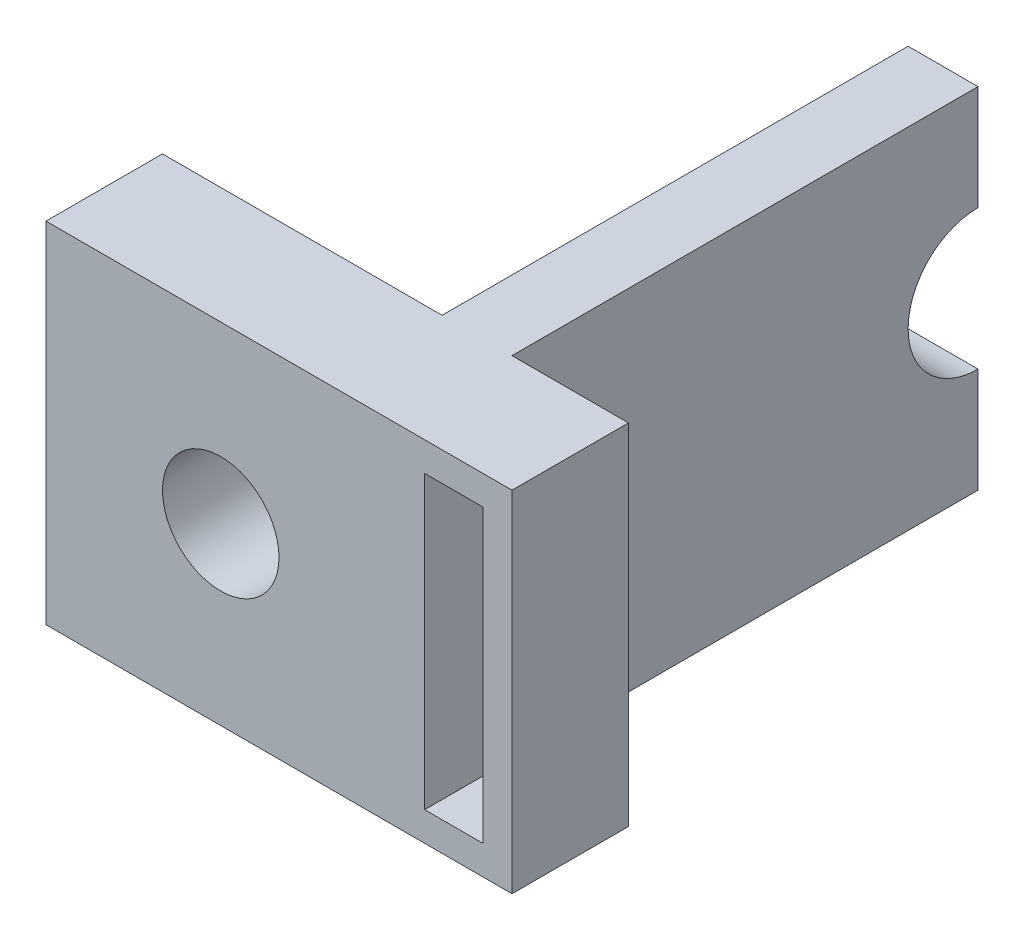
from build123d import *

# Parameters (mm, degrees)
SKETCH1_W               = 20
SKETCH1_H               = 15
BOSS_EXTRUDE1_DEPTH     = 5
SKETCH2_R               = 2.5
CUT_EXTRUDE1_DEPTH      = 5
SKETCH3_W               = 3
SKETCH3_H               = 15
BOSS_EXTRUDE2_DEPTH     = 20
CUT_EXTRUDE2_DEPTH      = 30.154759474
CUT_EXTRUDE2_DEPTH_BACK = 30.154759474
SKETCH5_W               = 2.5
SKETCH5_H               = 12.5
CUT_EXTRUDE3_DEPTH      = 33.015621187


with BuildPart() as part:
    # Sketch1 → Boss-Extrude1 (new body)
    with BuildSketch(Plane.XY):
        with Locations((10, 7.5)):
            Rectangle(SKETCH1_W, SKETCH1_H)
    extrude(amount=BOSS_EXTRUDE1_DEPTH)

    # Sketch2 → Cut-Extrude1 (cut)
    with BuildSketch(Plane.XY.offset(5)):
        with Locations((7.5, 7.5)):
            Circle(SKETCH2_R)
    extrude(amount=-CUT_EXTRUDE1_DEPTH, mode=Mode.SUBTRACT)

    # Sketch3 → Boss-Extrude2 (add)
    with BuildSketch(Plane(origin=(0, 0, 0), x_dir=(-1, 0, 0), z_dir=(0, 0, -1))):
        with Locations((-13.5, 7.5)):
            Rectangle(SKETCH3_W, SKETCH3_H)
    extrude(amount=BOSS_EXTRUDE2_DEPTH)

    # Sketch4 → Cut-Extrude2 (cut, two sides: drawn at the far end of the back side and taken through both)
    with BuildSketch(Plane(origin=(15, 0, 0), x_dir=(0, 0, -1), z_dir=(1, 0, 0)).offset(-CUT_EXTRUDE2_DEPTH_BACK)):
        with BuildLine():
            Line((84.230987452, 10.5), (20, 10.5))
            ThreePointArc((20, 10.5), (17, 7.5), (20, 4.5))
            Line((20, 4.5), (84.230987452, 4.5))
            Line((84.230987452, 4.5), (212.692962355, 4.5))
            Line((212.692962355, 4.5), (212.692962355, 10.5))
            Line((212.692962355, 10.5), (84.230987452, 10.5))
        make_face()
    extrude(amount=CUT_EXTRUDE2_DEPTH + CUT_EXTRUDE2_DEPTH_BACK, mode=Mode.SUBTRACT)

    # Sketch5 → Cut-Extrude3 (cut, through all)
    with BuildSketch(Plane(origin=(0, 0, 0), x_dir=(-1, 0, 0), z_dir=(0, 0, -1))):
        with Locations((-17.5, 7.5)):
            Rectangle(SKETCH5_W, SKETCH5_H)
    extrude(amount=-CUT_EXTRUDE3_DEPTH, mode=Mode.SUBTRACT)


solid = part.part
